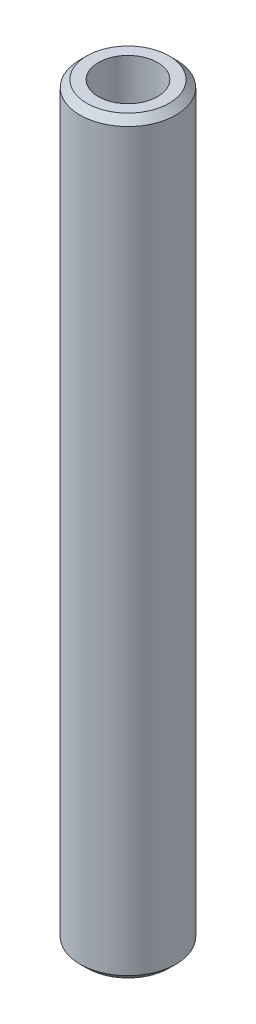
from build123d import *

# Parameters (mm, degrees)
SKETCH1_R           = 37.5
BOSS_EXTRUDE1_DEPTH = 585.959490334
SKETCH2_R           = 23.16034936
CUT_EXTRUDE1_DEPTH  = 589.354505645
CHAMFER1_SIZE       = 5.335399947


with BuildPart() as part:
    # Sketch1 → Boss-Extrude1 (new body)
    with BuildSketch(Plane(origin=(0, 0, 0), x_dir=(1, 0, 0), z_dir=(0, 1, 0))):
        Circle(SKETCH1_R)
    extrude(amount=BOSS_EXTRUDE1_DEPTH)

    # Sketch2 → Cut-Extrude1 (cut, through all)
    with BuildSketch(Plane(origin=(0, 0, 0), x_dir=(1, 0, 0), z_dir=(0, 1, 0))):
        Circle(SKETCH2_R)
    extrude(amount=CUT_EXTRUDE1_DEPTH, mode=Mode.SUBTRACT)

    # Chamfer1
    chamfer1_edges = [part.edges().sort_by_distance(p)[0] for p in [
        (-37.5, 585.959490334, 0),
        (-37.5, 0, 0),
    ]]
    chamfer(chamfer1_edges, length=CHAMFER1_SIZE)


solid = part.part
